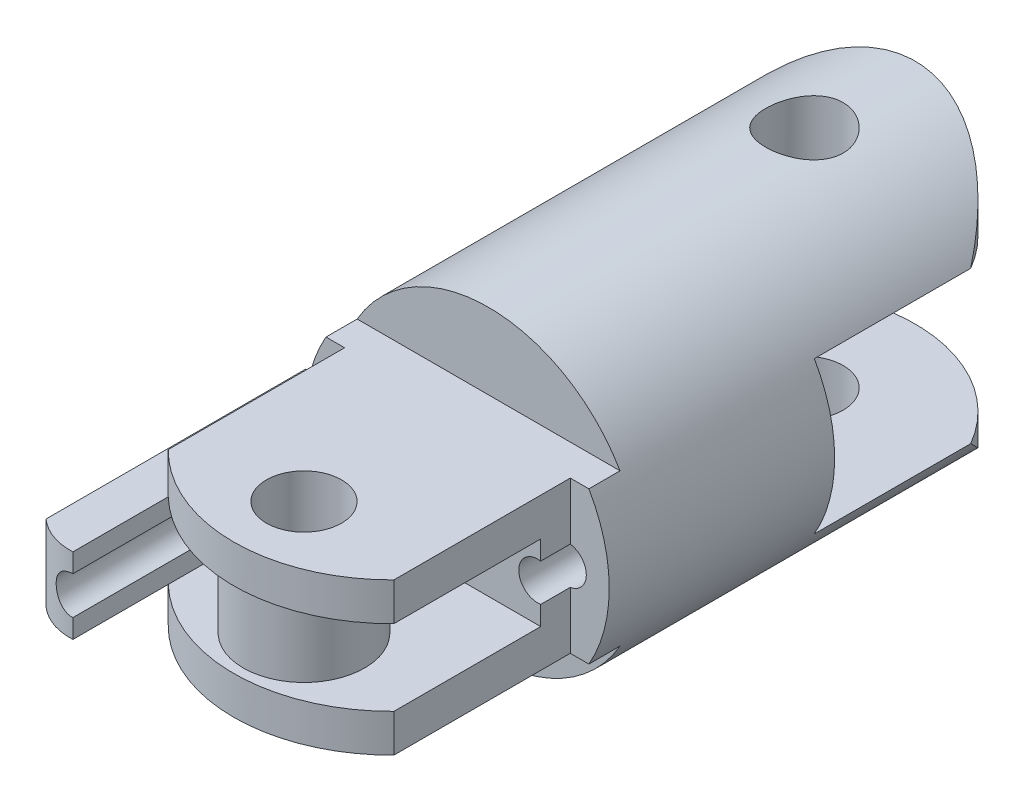
from build123d import *
from build123d.topology import SkipClean

# Parameters (mm, degrees)
SKETCH2_R                       = 10
PHALANGE_LENGTH_DEPTH           = 16.8
BOSS_EXTRUDE3_DEPTH             = 5
BOSS_EXTRUDE4_DEPTH             = 5
BOSS_EXTRUDE4_DEPTH_BACK        = 5
CUT_EXTRUDE2_START              = -15.3025
CUT_EXTRUDE2_DEPTH              = 15.3025
SKETCH7_R                       = 1.65
CUT_EXTRUDE3_DEPTH              = 10
CUT_EXTRUDE4_DEPTH              = 2.5
CUT_EXTRUDE4_DEPTH_BACK         = 2.5
CUT_EXTRUDE7_REACH              = 38.861
SKETCH4_R                       = 1.65
CUT_EXTRUDE7_DIRECTION_2_REACH  = 38.861
CUT_EXTRUDE_THIN1_START         = 16.8
CUT_EXTRUDE_THIN1_DEPTH         = 10.361670454
BOSS_EXTRUDE5_REACH             = 37.917
SKETCH9_R                       = 4
SKETCH9_R_2                     = 1.65
CUT_EXTRUDE8_REACH              = 37.079
SKETCH10_R                      = 1.25
CUT_EXTRUDE9_START              = -4
CUT_EXTRUDE9_DEPTH              = 4
CUT_EXTRUDE10_REACH             = 37.917
CUT_EXTRUDE10_DIRECTION_2_REACH = 37.917
CUT_EXTRUDE11_START             = -10
CUT_EXTRUDE11_OUTLINE_W         = 2.565773848
CUT_EXTRUDE11_OUTLINE_H         = 11.6166929
CUT_EXTRUDE11_DEPTH             = 10
BOSS_EXTRUDE7_REACH             = 35.643
CUT_EXTRUDE12_REACH             = 37.079
SKETCH10_2_R                    = 1.25
CUT_EXTRUDE12_DIRECTION_2_REACH = 37.079
SKETCH17_R                      = 1.25
SKETCH17_W                      = 2.42123439
SKETCH17_H                      = 5
CUT_EXTRUDE14_DEPTH             = 16.148519
SCALE1_SCALE                    = 0.666666667
CUT_EXTRUDE15_START             = -10
SKETCH18_R                      = 1.65
CUT_EXTRUDE15_DEPTH             = 13.333338
CUT_EXTRUDE16_START             = -3.333333
SKETCH19_R                      = 1.7
CUT_EXTRUDE16_DEPTH             = 13.333338


# Read off the part's stored shape, not the designer's step: Cut-Extrude-Thin1, Cut-Extrude11
with BuildPart() as part:
    # Sketch2 → Phalange Length (new body)
    with BuildSketch(Plane.XY):
        Circle(SKETCH2_R)
    extrude(amount=PHALANGE_LENGTH_DEPTH)

    # Sketch3 → Boss-Extrude3 (add)
    with BuildSketch(Plane(origin=(0, -10, 0), x_dir=(-1, 0, 0), z_dir=(0, -1, 0))):
        with BuildLine():
            Line((-10, 5.302499701), (-10, 0))
            Line((-10, 0), (10, 0))
            Line((10, 0), (10, 5.302499701))
            ThreePointArc((10, 5.302499701), (0, 15.302499701), (-10, 5.302499701))
        make_face()
    boss_extrude3 = extrude(amount=-BOSS_EXTRUDE3_DEPTH)

    # Mirror1: Boss-Extrude3 across plane
    add(boss_extrude3.mirror(Plane.ZX))

    # Sketch5 → Boss-Extrude4 (add, two sides: drawn at the far end of the back side and taken through both)
    with BuildSketch(Plane(origin=(0, 0, 0), x_dir=(1, 0, 0), z_dir=(0, 1, 0)).offset(-BOSS_EXTRUDE4_DEPTH_BACK)):
        with BuildLine():
            Line((-10, -22.583157911), (-10, -16.8))
            Line((-10, -16.8), (10, -16.8))
            Line((10, -16.8), (10, -22.583157911))
            ThreePointArc((10, -22.583157911), (0, -32.151984156), (-10, -22.583157911))
        make_face()
    extrude(amount=BOSS_EXTRUDE4_DEPTH + BOSS_EXTRUDE4_DEPTH_BACK)

    # Sketch6 → Cut-Extrude2 (cut)
    with SkipClean():  # the faces are left unmerged after this step: merging them gives an invalid solid
        with BuildSketch(Plane.XY.offset(CUT_EXTRUDE2_START)):
            with BuildLine():
                ThreePointArc((0, 10), (5, 8.660254038), (8.660254038, 5))
                Line((8.660254038, 5), (10, 5))
                Line((10, 5), (10, 10))
                Line((10, 10), (0, 10))
            make_face()
            with BuildLine():
                Line((10, -5), (8.660254038, -5))
                ThreePointArc((8.660254038, -5), (5, -8.660254038), (0, -10))
                Line((0, -10), (10, -10))
                Line((10, -10), (10, -5))
            make_face()
            with BuildLine():
                ThreePointArc((-8.660254038, 5), (-5, 8.660254038), (0, 10))
                Line((0, 10), (-10, 10))
                Line((-10, 10), (-10, 5))
                Line((-10, 5), (-8.660254038, 5))
            make_face()
            with BuildLine():
                Line((-10, -10), (0, -10))
                ThreePointArc((0, -10), (-5, -8.660254038), (-8.660254038, -5))
                Line((-8.660254038, -5), (-10, -5))
                Line((-10, -5), (-10, -10))
            make_face()
        extrude(amount=CUT_EXTRUDE2_DEPTH, mode=Mode.SUBTRACT)

    # Sketch7 → Cut-Extrude3 (cut)
    with SkipClean():  # the faces are left unmerged after this step: merging them gives an invalid solid
        with BuildSketch(Plane(origin=(0, 5, 0), x_dir=(1, 0, 0), z_dir=(0, 1, 0))):
            with Locations(Location((0, -24.961984156, 0), (0, 0, 270))):
                Circle(SKETCH7_R)
        extrude(amount=-CUT_EXTRUDE3_DEPTH, mode=Mode.SUBTRACT)

    # Sketch5<2> → Cut-Extrude4 (cut, two sides: drawn at the far end of the back side and taken through both)
    with BuildSketch(Plane(origin=(0, 0, 0), x_dir=(1, 0, 0), z_dir=(0, 1, 0)).offset(-CUT_EXTRUDE4_DEPTH_BACK)):
        with BuildLine():
            Line((-10, -22.583157911), (-10, -16.8))
            Line((-10, -16.8), (10, -16.8))
            Line((10, -16.8), (10, -22.583157911))
            ThreePointArc((10, -22.583157911), (0, -32.151984156), (-10, -22.583157911))
        make_face()
    extrude(amount=CUT_EXTRUDE4_DEPTH + CUT_EXTRUDE4_DEPTH_BACK, mode=Mode.SUBTRACT)

    # Sketch4 → Cut-Extrude7 (cut, up to next)
    with BuildSketch(Plane(origin=(0, -5, 0), x_dir=(1, 0, 0), z_dir=(0, 1, 0)), mode=Mode.PRIVATE) as cut_extrude7_sk1:
        with Locations(Location((0, 8.010159673, 0), (0, 0, 270))):
            Circle(SKETCH4_R)
    cut_extrude7_tool1 = extrude(cut_extrude7_sk1.sketch, amount=-CUT_EXTRUDE7_REACH, mode=Mode.PRIVATE) & part.part
    add(cut_extrude7_tool1.solids().sort_by_distance((0, -5, -8.01016))[0], mode=Mode.SUBTRACT)

    # Sketch4 → Cut-Extrude7 direction 2 (cut, up to next)
    with BuildSketch(Plane(origin=(0, -5, 0), x_dir=(1, 0, 0), z_dir=(0, 1, 0)), mode=Mode.PRIVATE) as cut_extrude7_direction_2_sk1:
        with Locations(Location((0, 8.010159673, 0), (0, 0, 270))):
            Circle(SKETCH4_R)
    cut_extrude7_direction_2_tool1 = extrude(cut_extrude7_direction_2_sk1.sketch, amount=CUT_EXTRUDE7_DIRECTION_2_REACH, mode=Mode.PRIVATE) & part.part
    add(cut_extrude7_direction_2_tool1.solids().sort_by_distance((0, -5, -8.01016))[0], mode=Mode.SUBTRACT)

    # Cut-Extrude-Thin1 outline → Cut-Extrude-Thin1 (cut)
    with SkipClean():  # the faces are left unmerged after this step: merging them gives an invalid solid
        with BuildSketch(Plane.XY.offset(CUT_EXTRUDE_THIN1_START)):
            with BuildLine():
                ThreePointArc((8.660254038, 5), (9.256147934, 3.78466979), (9.682458366, 2.5))
                Line((9.682458366, 2.5), (10, 2.5))
                Line((10, 2.5), (10, 5))
                Line((10, 5), (8.660254038, 5))
            make_face()
            with BuildLine():
                Line((10, -2.5), (9.682458366, -2.5))
                ThreePointArc((9.682458366, -2.5), (9.256147934, -3.78466979), (8.660254038, -5))
                Line((8.660254038, -5), (10, -5))
                Line((10, -5), (10, -2.5))
            make_face()
            with BuildLine():
                Line((-10, 2.5), (-9.682458366, 2.5))
                ThreePointArc((-9.682458366, 2.5), (-9.256147934, 3.78466979), (-8.660254038, 5))
                Line((-8.660254038, 5), (-10, 5))
                Line((-10, 5), (-10, 2.5))
            make_face()
            with BuildLine():
                ThreePointArc((-8.660254038, -5), (-9.256147934, -3.78466979), (-9.682458366, -2.5))
                Line((-9.682458366, -2.5), (-10, -2.5))
                Line((-10, -2.5), (-10, -5))
                Line((-10, -5), (-8.660254038, -5))
            make_face()
        extrude(amount=CUT_EXTRUDE_THIN1_DEPTH, mode=Mode.SUBTRACT)

    # Sketch9 → Boss-Extrude5 (add, up to next)
    with BuildSketch(Plane.XZ.offset(-2.5), mode=Mode.PRIVATE) as boss_extrude5_sk1:
        with Locations(Location((0, 24.961984156, 0), (0, 0, 90))):
            Circle(SKETCH9_R)
        with Locations(Location((0, 24.961984156, 0), (0, 0, 90))):
            Circle(SKETCH9_R_2, mode=Mode.SUBTRACT)
    boss_extrude5_tool1 = extrude(boss_extrude5_sk1.sketch, amount=BOSS_EXTRUDE5_REACH, mode=Mode.PRIVATE) - part.part
    add(boss_extrude5_tool1.solids().sort_by_distance((0, 2.5, 21.075121))[0])

    # Sketch10 → Cut-Extrude8 (cut, up to next)
    with BuildSketch(Plane.XY.offset(16.8), mode=Mode.PRIVATE) as cut_extrude8_sk1:
        with Locations((7.239961745, 0)):
            Circle(SKETCH10_R)
    cut_extrude8_tool1 = extrude(cut_extrude8_sk1.sketch, amount=-CUT_EXTRUDE8_REACH, mode=Mode.PRIVATE) & part.part
    # Sketch10 → Cut-Extrude8 (cut, up to next)
    with BuildSketch(Plane.XY.offset(16.8), mode=Mode.PRIVATE) as cut_extrude8_sk2:
        with Locations((-7.239961745, 0)):
            Circle(SKETCH10_R)
    cut_extrude8_tool2 = extrude(cut_extrude8_sk2.sketch, amount=-CUT_EXTRUDE8_REACH, mode=Mode.PRIVATE) & part.part
    add(cut_extrude8_tool1.solids().sort_by_distance((7.239962, 0, 16.8))[0], mode=Mode.SUBTRACT)
    add(cut_extrude8_tool2.solids().sort_by_distance((-7.239962, 0, 16.8))[0], mode=Mode.SUBTRACT)

    # Sketch11 → Cut-Extrude9 (cut)
    with SkipClean():  # the faces are left unmerged after this step: merging them gives an invalid solid
        with BuildSketch(Plane.XY.offset(16.8).offset(CUT_EXTRUDE9_START)):
            with BuildLine():
                ThreePointArc((8.660254038, 5), (0, 10), (-8.660254038, 5))
                Line((-8.660254038, 5), (8.660254038, 5))
            make_face()
            with BuildLine():
                Line((8.660254038, -5), (-8.660254038, -5))
                ThreePointArc((-8.660254038, -5), (0, -10), (8.660254038, -5))
            make_face()
        extrude(amount=CUT_EXTRUDE9_DEPTH, mode=Mode.SUBTRACT)

    # Sketch12 → Cut-Extrude10 (cut, up to next)
    with BuildSketch(Plane.XZ.offset(-2.5), mode=Mode.PRIVATE) as cut_extrude10_sk1:
        with BuildLine():
            Line((-10.033719202, 32.151984156), (-10.033719202, 24.964892021))
            Line((-10.033719202, 24.964892021), (-8.660254038, 24.964892021))
            ThreePointArc((-8.660254038, 24.964892021), (0, 29.590740593), (8.660254038, 24.964892021))
            Line((8.660254038, 24.964892021), (10.033719202, 24.964892021))
            Line((10.033719202, 24.964892021), (10.033719202, 32.151984156))
            Line((10.033719202, 32.151984156), (-10.033719202, 32.151984156))
        make_face()
    cut_extrude10_tool1 = extrude(cut_extrude10_sk1.sketch, amount=CUT_EXTRUDE10_REACH, mode=Mode.PRIVATE) & part.part
    add(cut_extrude10_tool1.solids().sort_by_distance((0, 2.5, 29.650279))[0], mode=Mode.SUBTRACT)

    # Sketch12 → Cut-Extrude10 direction 2 (cut, up to next)
    with BuildSketch(Plane.XZ.offset(-2.5), mode=Mode.PRIVATE) as cut_extrude10_direction_2_sk1:
        with BuildLine():
            Line((-10.033719202, 32.151984156), (-10.033719202, 24.964892021))
            Line((-10.033719202, 24.964892021), (-8.660254038, 24.964892021))
            ThreePointArc((-8.660254038, 24.964892021), (0, 29.590740593), (8.660254038, 24.964892021))
            Line((8.660254038, 24.964892021), (10.033719202, 24.964892021))
            Line((10.033719202, 24.964892021), (10.033719202, 32.151984156))
            Line((10.033719202, 32.151984156), (-10.033719202, 32.151984156))
        make_face()
    cut_extrude10_direction_2_tool1 = extrude(cut_extrude10_direction_2_sk1.sketch, amount=-CUT_EXTRUDE10_DIRECTION_2_REACH, mode=Mode.PRIVATE) & part.part
    add(cut_extrude10_direction_2_tool1.solids().sort_by_distance((0, 2.5, 29.650279))[0], mode=Mode.SUBTRACT)

    # Cut-Extrude11 outline → Cut-Extrude11 (cut)
    with BuildSketch(Plane.XZ.offset(5).offset(CUT_EXTRUDE11_START)):
        with Locations((-8.717113076, 20.660571369)):
            Rectangle(CUT_EXTRUDE11_OUTLINE_W, CUT_EXTRUDE11_OUTLINE_H)
        with Locations((8.717113076, 20.660571369)):
            Rectangle(CUT_EXTRUDE11_OUTLINE_W, CUT_EXTRUDE11_OUTLINE_H)
    extrude(amount=CUT_EXTRUDE11_DEPTH, mode=Mode.SUBTRACT)

    # Boss-Extrude7: up to this face of the body (flat: up to its plane)
    boss_extrude7_end = Plane(part.part.faces().sort_by_distance((0, 2.5, 16.996174341))[0])
    # Sketch16 → Boss-Extrude7 (add, up to the picked face)
    with BuildSketch(Plane(origin=(0, -2.5, 0), x_dir=(1, 0, 0), z_dir=(0, 1, 0)), mode=Mode.PRIVATE) as boss_extrude7_sk1:
        with BuildLine():
            Line((-4.818727355, -14.852224919), (-7.434226152, -14.852224919))
            Line((-7.434226152, -14.852224919), (-10, -14.852224919))
            Line((-10, -14.852224919), (-10, -31.958561033))
            ThreePointArc((-10, -31.958561033), (-8.808295471, -32.690817912), (-7.43422564, -32.952145139))
            ThreePointArc((-7.43422564, -32.952145139), (-6.033645007, -32.699721533), (-4.818727355, -31.958561033))
            Line((-4.818727355, -31.958561033), (-4.818727355, -28.409527951))
            ThreePointArc((-4.818727355, -28.409527951), (-6.204248493, -27.542230104), (-7.437080645, -26.468917819))
            Line((-7.437080645, -26.468917819), (-7.434226152, -26.468917819))
            Line((-7.434226152, -26.468917819), (-7.434226152, -16.8))
            Line((-7.434226152, -16.8), (-4.818727355, -16.8))
            Line((-4.818727355, -16.8), (-4.818727355, -14.852224919))
        make_face()
    boss_extrude7_tool1 = split(extrude(boss_extrude7_sk1.sketch, amount=BOSS_EXTRUDE7_REACH, mode=Mode.PRIVATE), bisect_by=boss_extrude7_end, keep=Keep.BOTH, mode=Mode.PRIVATE)
    # Sketch16 → Boss-Extrude7 (add, up to the picked face)
    with BuildSketch(Plane(origin=(0, -2.5, 0), x_dir=(1, 0, 0), z_dir=(0, 1, 0)), mode=Mode.PRIVATE) as boss_extrude7_sk2:
        with BuildLine():
            Line((-4.818727355, -28.409527951), (-4.818727355, -16.8))
            Line((-4.818727355, -16.8), (-7.434226152, -16.8))
            Line((-7.434226152, -16.8), (-7.434226152, -26.468917819))
            Line((-7.434226152, -26.468917819), (-7.437080645, -26.468917819))
            ThreePointArc((-7.437080645, -26.468917819), (-6.204248493, -27.542230104), (-4.818727355, -28.409527951))
        make_face()
    boss_extrude7_tool2 = split(extrude(boss_extrude7_sk2.sketch, amount=BOSS_EXTRUDE7_REACH, mode=Mode.PRIVATE), bisect_by=boss_extrude7_end, keep=Keep.BOTH, mode=Mode.PRIVATE)
    add(boss_extrude7_tool1.solids().sort_by(Axis((-7.989429, -2.5, 24.433344), (0, 1, 0)))[0])
    add(boss_extrude7_tool2.solids().sort_by(Axis((-6.08748, -2.5, 22.1879), (0, 1, 0)))[0])

    # Sketch10<2> → Cut-Extrude12 (cut, up to next)
    with BuildSketch(Plane.XY.offset(16.8), mode=Mode.PRIVATE) as cut_extrude12_sk1:
        with Locations((-7.239961745, 0)):
            Circle(SKETCH10_2_R)
    cut_extrude12_tool1 = extrude(cut_extrude12_sk1.sketch, amount=CUT_EXTRUDE12_REACH, mode=Mode.PRIVATE) & part.part
    add(cut_extrude12_tool1.solids().sort_by_distance((-7.239962, 0, 16.8))[0], mode=Mode.SUBTRACT)

    # Sketch10<2> → Cut-Extrude12 direction 2 (cut, up to next)
    with BuildSketch(Plane.XY.offset(16.8), mode=Mode.PRIVATE) as cut_extrude12_direction_2_sk1:
        with Locations((-7.239961745, 0)):
            Circle(SKETCH10_2_R)
    cut_extrude12_direction_2_tool1 = extrude(cut_extrude12_direction_2_sk1.sketch, amount=-CUT_EXTRUDE12_DIRECTION_2_REACH, mode=Mode.PRIVATE) & part.part
    add(cut_extrude12_direction_2_tool1.solids().sort_by_distance((-7.239962, 0, 16.8))[0], mode=Mode.SUBTRACT)

    # Sketch17 → Cut-Extrude14 (cut)
    with SkipClean():  # the faces are left unmerged after this step: merging them gives an invalid solid
        with BuildSketch(Plane.XY.offset(16.8)):
            with Locations((-7.239961745, 0)):
                Circle(SKETCH17_R)
            with Locations((-6.02934455, 0)):
                Rectangle(SKETCH17_W, SKETCH17_H)
        extrude(amount=CUT_EXTRUDE14_DEPTH, mode=Mode.SUBTRACT)


with BuildPart() as part_1:
    # Scale1: scaled about (-0.235925665, -2.1e-07, 6.856472765)
    add(part.part.scale(SCALE1_SCALE).moved(Location((-0.078641888, -7e-08, 2.285490922))))

    # Sketch18 → Cut-Extrude15 (cut)
    with BuildSketch(Plane(origin=(0, 3.333328812, 0), x_dir=(1, 0, 0), z_dir=(0, 1, 0)).offset(CUT_EXTRUDE15_START)):
        with Locations(Location((-0.078652268, -18.926980833, 0), (0, 0, 270))):
            Circle(SKETCH18_R)
    extrude(amount=CUT_EXTRUDE15_DEPTH, mode=Mode.SUBTRACT)

    # Sketch19 → Cut-Extrude16 (cut)
    with BuildSketch(Plane(origin=(0, -3.333337854, 0), x_dir=(1, 0, 0), z_dir=(0, 1, 0)).offset(CUT_EXTRUDE16_START)):
        with Locations(Location((-0.078652268, 3.054448386, 0), (0, 0, 90))):
            Circle(SKETCH19_R)
    extrude(amount=CUT_EXTRUDE16_DEPTH, mode=Mode.SUBTRACT)


solid = part_1.part
